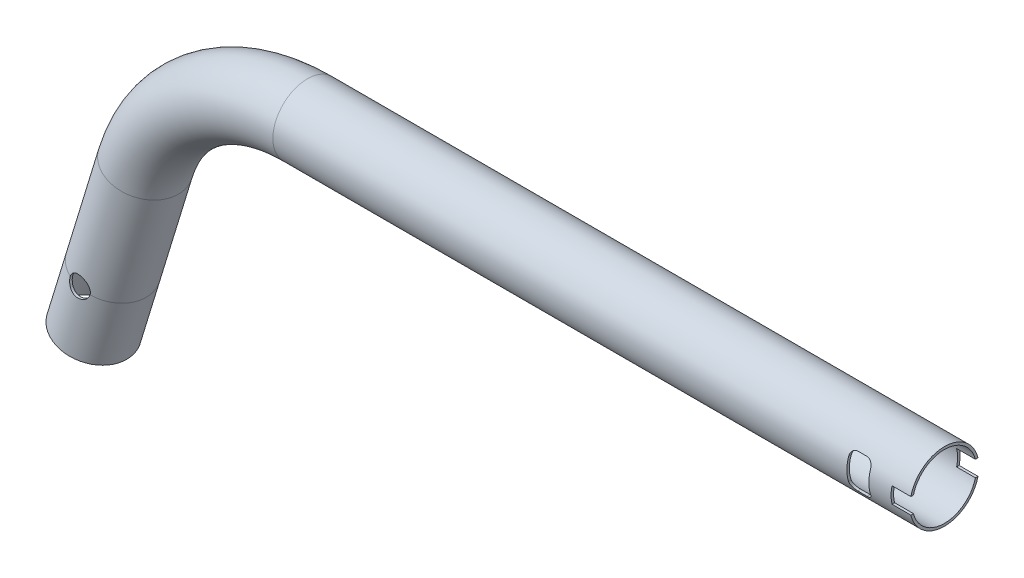
from build123d import *

# Parameters (mm, degrees)
SKETCH3_R          = 11
SKETCH3_R_2        = 10.2
CUT_EXTRUDE1_REACH = 198.729
SKETCH4_R          = 3.3
SKETCH4_W          = 6.005730682
SKETCH4_H          = 5.111091306
SKETCH5_R          = 3.3
CUT_EXTRUDE2_DEPTH = 197.728931122
SKETCH6_W          = 6.005730682
SKETCH6_H          = 5.111091306
CUT_EXTRUDE3_DEPTH = 197.728931122


with BuildPart() as part:
    # Sweep2: sweep along a path in Sketch1
    with BuildLine(Plane.XY) as sweep2_path:
        Line((109.79531951, 0), (93.19531951, 0))
        Line((93.19531951, 0), (-93.19531951, 0))
        ThreePointArc((-93.19531951, 0), (-125.315749994, -10.591729527), (-144.835776332, -38.211927945))
        Line((-144.835776332, -38.211927945), (-155.10468049, -71.8))
        Line((-155.10468049, -71.8), (-161.280440256, -92))
    # Sketch3 → Sweep2 (sweep)
    with BuildSketch(Plane(origin=(93.19531951, 0, 0), x_dir=(0, 0, -1), z_dir=(1, 0, 0))):
        Circle(SKETCH3_R)
        Circle(SKETCH3_R_2, mode=Mode.SUBTRACT)
    sweep(path=sweep2_path.line)

    # Sketch4 → Cut-Extrude1 (cut, up to next)
    with BuildSketch(Plane.XY, mode=Mode.PRIVATE) as cut_extrude1_sk1:
        with Locations((-155.10468049, -71.8)):
            Circle(SKETCH4_R)
    cut_extrude1_tool1 = extrude(cut_extrude1_sk1.sketch, amount=CUT_EXTRUDE1_REACH, mode=Mode.PRIVATE) & part.part
    # Sketch4 → Cut-Extrude1 (cut, up to next)
    with BuildSketch(Plane.XY, mode=Mode.PRIVATE) as cut_extrude1_sk2:
        with BuildLine():
            Line((91.69531951, -5.5), (94.69531951, -5.5))
            ThreePointArc((94.69531951, -5.5), (96.109533072, -4.914213562), (96.69531951, -3.5))
            Line((96.69531951, -3.5), (96.69531951, 3.5))
            ThreePointArc((96.69531951, 3.5), (96.109533072, 4.914213562), (94.69531951, 5.5))
            Line((94.69531951, 5.5), (91.69531951, 5.5))
            ThreePointArc((91.69531951, 5.5), (90.281105947, 4.914213562), (89.69531951, 3.5))
            Line((89.69531951, 3.5), (89.69531951, -3.5))
            ThreePointArc((89.69531951, -3.5), (90.281105947, -4.914213562), (91.69531951, -5.5))
        make_face()
    cut_extrude1_tool2 = extrude(cut_extrude1_sk2.sketch, amount=CUT_EXTRUDE1_REACH, mode=Mode.PRIVATE) & part.part
    # Sketch4 → Cut-Extrude1 (cut, up to next)
    with BuildSketch(Plane.XY, mode=Mode.PRIVATE) as cut_extrude1_sk3:
        with Locations((106.792454169, 0)):
            Rectangle(SKETCH4_W, SKETCH4_H)
    cut_extrude1_tool3 = extrude(cut_extrude1_sk3.sketch, amount=CUT_EXTRUDE1_REACH, mode=Mode.PRIVATE) & part.part
    add(cut_extrude1_tool1.solids().sort_by_distance((-155.10468, -71.8, 0))[0], mode=Mode.SUBTRACT)
    add(cut_extrude1_tool2.solids().sort_by_distance((93.19532, 0, 0))[0], mode=Mode.SUBTRACT)
    add(cut_extrude1_tool3.solids().sort_by_distance((106.792454, 0, 0))[0], mode=Mode.SUBTRACT)

    # Sketch5 → Cut-Extrude2 (cut, through all)
    with BuildSketch(Plane.XY):
        with Locations((-155.10468049, -71.8)):
            Circle(SKETCH5_R)
    extrude(amount=-CUT_EXTRUDE2_DEPTH, mode=Mode.SUBTRACT)

    # Sketch6 → Cut-Extrude3 (cut, through all)
    with BuildSketch(Plane.XY):
        with Locations((106.792454169, 0)):
            Rectangle(SKETCH6_W, SKETCH6_H)
    extrude(amount=-CUT_EXTRUDE3_DEPTH, mode=Mode.SUBTRACT)


solid = part.part
